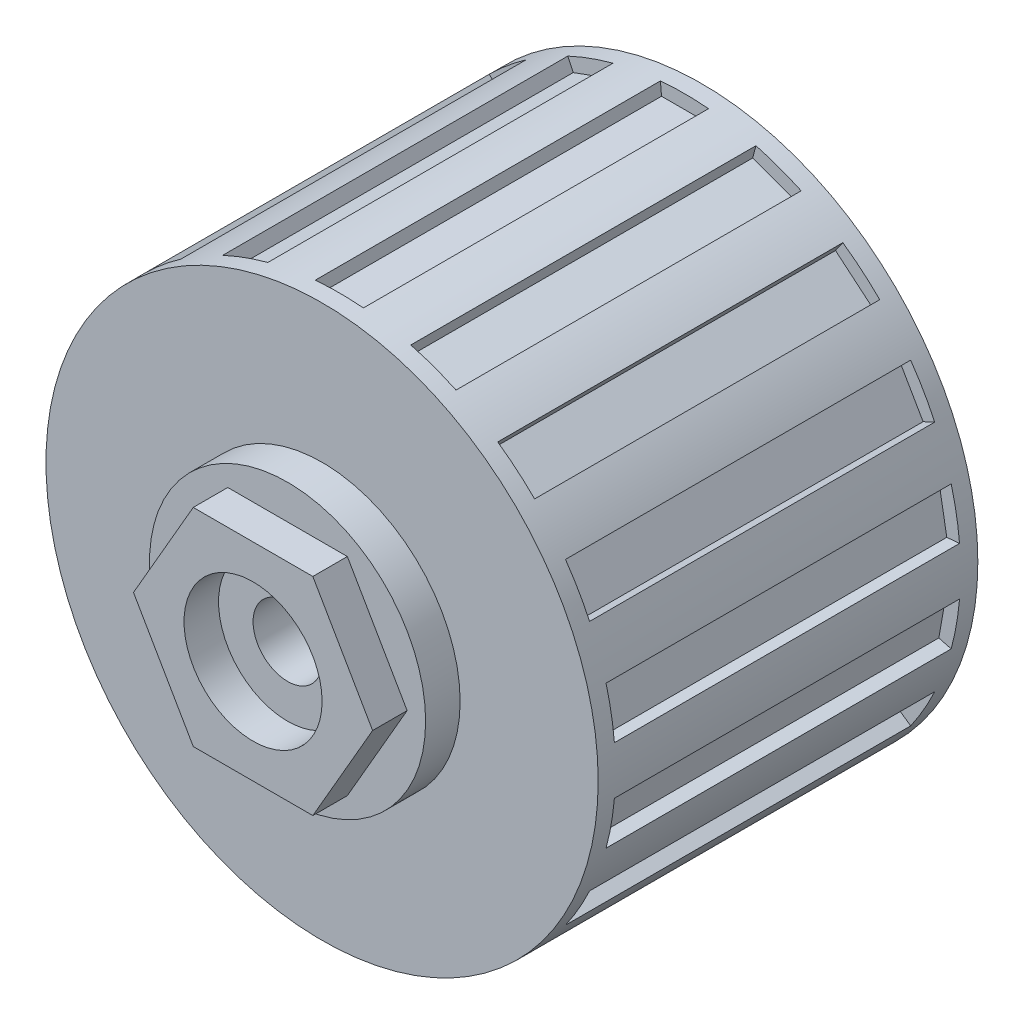
from build123d import *

# Parameters (mm, degrees)
SKETCH_1_R               = 80
SKETCH_1_R_2             = 10
EXTRUDE_1_DEPTH          = 120
CUT_EXTRUDE_START        = -100
CUT_EXTRUDE_1_DEPTH      = 100
PATTERN_CIRCULAR_1_COUNT = 18
SKETCH_3_R               = 50
SKETCH_3_R_2             = 20
EXTRUDE_2_DEPTH          = 3
SKETCH_4_R               = 20
EXTRUDE_3_DEPTH          = 10
SKETCH_5_OUTSIDE_W       = 214.192
SKETCH_5_OUTSIDE_H       = 214.192
SKETCH_5_OUTSIDE_R       = 40
CUT_EXTRUDE_2_DEPTH      = 10
SKETCH_6_R               = 40
SKETCH_6_R_2             = 10
EXTRUDE_4_DEPTH          = 10


with BuildPart() as part:
    # 草图1 → 凸台-拉伸1 (new body)
    with BuildSketch(Plane.XY):
        Circle(SKETCH_1_R)
        Circle(SKETCH_1_R_2, mode=Mode.SUBTRACT)
    extrude(amount=EXTRUDE_1_DEPTH)

    # 草图2 → 切除-拉伸1 (cut)
    with BuildSketch(Plane.XY.offset(105).offset(CUT_EXTRUDE_START)):
        with BuildLine():
            Line((-6.649138428, 76), (-6.97245942, 79.695575847))
            ThreePointArc((-6.97245942, 79.695575847), (0, 80), (6.97245942, 79.695575847))
            Line((6.97245942, 79.695575847), (6.649138428, 76))
            Line((6.649138428, 76), (-6.649138428, 76))
        make_face()
    cut_extrude_1 = extrude(amount=CUT_EXTRUDE_1_DEPTH, mode=Mode.SUBTRACT)

    # 阵列(圆周)1: 切除-拉伸1 ×18 about axis
    pattern_circular_1_axis = Axis((0, 0, 120), (0, 0, -1))
    for i in range(1, PATTERN_CIRCULAR_1_COUNT):
        add(cut_extrude_1.rotate(pattern_circular_1_axis, i * 360 / PATTERN_CIRCULAR_1_COUNT), mode=Mode.SUBTRACT)

    # 草图3 → 凸台-拉伸2 (add)
    with BuildSketch(Plane.XY.offset(120)):
        Circle(SKETCH_3_R)
        Circle(SKETCH_3_R_2, mode=Mode.SUBTRACT)
    extrude(amount=-EXTRUDE_2_DEPTH)

    # 草图4 → 凸台-拉伸3 (add)
    with BuildSketch(Plane.XY.offset(120)):
        Polygon((34.641016151, 0), (17.320508076, 30), (-17.320508076, 30), (-34.641016151, 0), (-17.320508076, -30), (17.320508076, -30), align=None)
        Circle(SKETCH_4_R, mode=Mode.SUBTRACT)
    extrude(amount=EXTRUDE_3_DEPTH)

    # 草图5 outside → 切除-拉伸2 (cut)
    with BuildSketch(Plane.XY.offset(120)):
        Rectangle(SKETCH_5_OUTSIDE_W, SKETCH_5_OUTSIDE_H)
        Circle(SKETCH_5_OUTSIDE_R, mode=Mode.SUBTRACT)
    extrude(amount=-CUT_EXTRUDE_2_DEPTH, mode=Mode.SUBTRACT)

    # 草图6 → 凸台-拉伸4 (add)
    with BuildSketch(Plane(origin=(0, 0, 0), x_dir=(-1, 0, 0), z_dir=(0, 0, -1))):
        Circle(SKETCH_6_R)
        Circle(SKETCH_6_R_2, mode=Mode.SUBTRACT)
    extrude(amount=EXTRUDE_4_DEPTH)


solid = part.part
